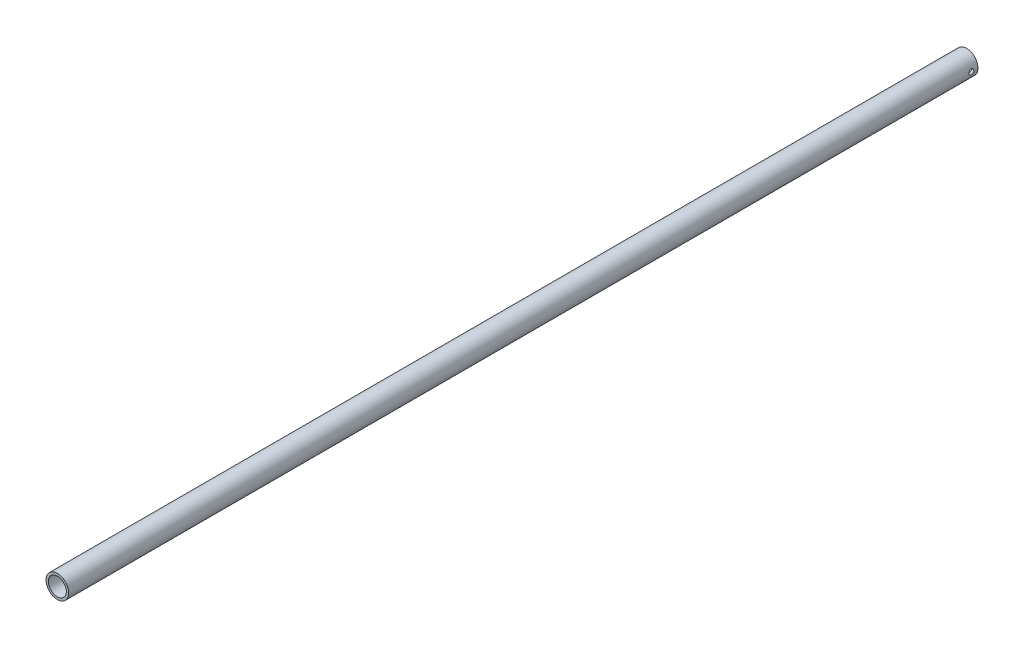
from build123d import *

# Parameters (mm, degrees)
SKETCH1_R               = 15.24
SKETCH1_R_2             = 12.065
BOSS_EXTRUDE1_DEPTH     = 1219.2
F_1_4_CLEARANCE_HOLE3_D = 6.7564


with BuildPart() as part:
    # Sketch1 → Boss-Extrude1 (new body)
    with BuildSketch(Plane.XY):
        Circle(SKETCH1_R)
        Circle(SKETCH1_R_2, mode=Mode.SUBTRACT)
    extrude(amount=BOSS_EXTRUDE1_DEPTH)

    # 1/4 Clearance Hole3 (through all)
    with Locations(Plane.ZY.offset(15.24)):
        with Locations((8.89, 0)):
            Hole(F_1_4_CLEARANCE_HOLE3_D / 2)


solid = part.part
